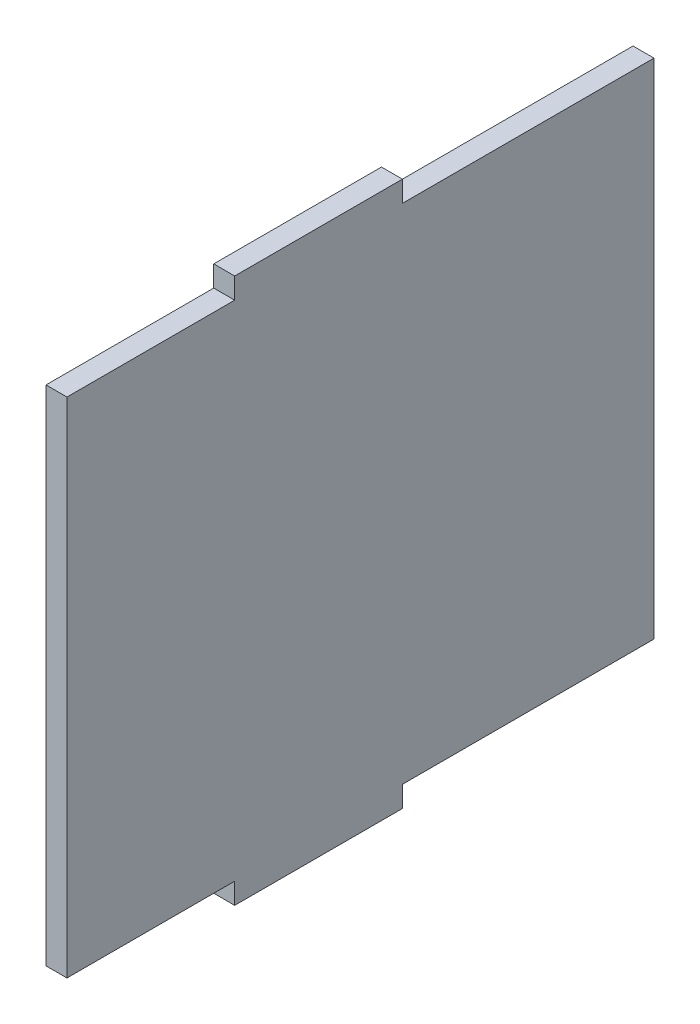
from build123d import *

# Parameters (mm, degrees)
SKETCH1_W           = 88.9
SKETCH1_H           = 82.55
BOSS_EXTRUDE1_DEPTH = 3.175
SKETCH2_W           = 38.1
SKETCH2_H           = 3.175
CUT_EXTRUDE1_DEPTH  = 61.741326541


with BuildPart() as part:
    # Sketch1 → Boss-Extrude1 (new body)
    with BuildSketch(Plane(origin=(0, 0, 0), x_dir=(0, 0, -1), z_dir=(1, 0, 0))):
        Rectangle(SKETCH1_W, SKETCH1_H)
    extrude(amount=BOSS_EXTRUDE1_DEPTH)

    # Sketch2 → Cut-Extrude1 (cut, through all)
    with BuildSketch(Plane(origin=(3.175, 0, 0), x_dir=(0, 0, -1), z_dir=(1, 0, 0))):
        with Locations((25.4, -39.6875)):
            Rectangle(SKETCH2_W, SKETCH2_H)
        Polygon((-19.05, 38.1), (-44.45, 38.1), (-44.45, 41.275), (-41.275, 41.275), (-19.05, 41.275), align=None)
        Polygon((-44.45, -41.275), (-41.275, -41.275), (-19.05, -41.275), (-19.05, -38.1), (-44.45, -38.1), align=None)
        with Locations((25.4, 39.6875)):
            Rectangle(SKETCH2_W, SKETCH2_H)
    extrude(amount=-CUT_EXTRUDE1_DEPTH, mode=Mode.SUBTRACT)


solid = part.part
